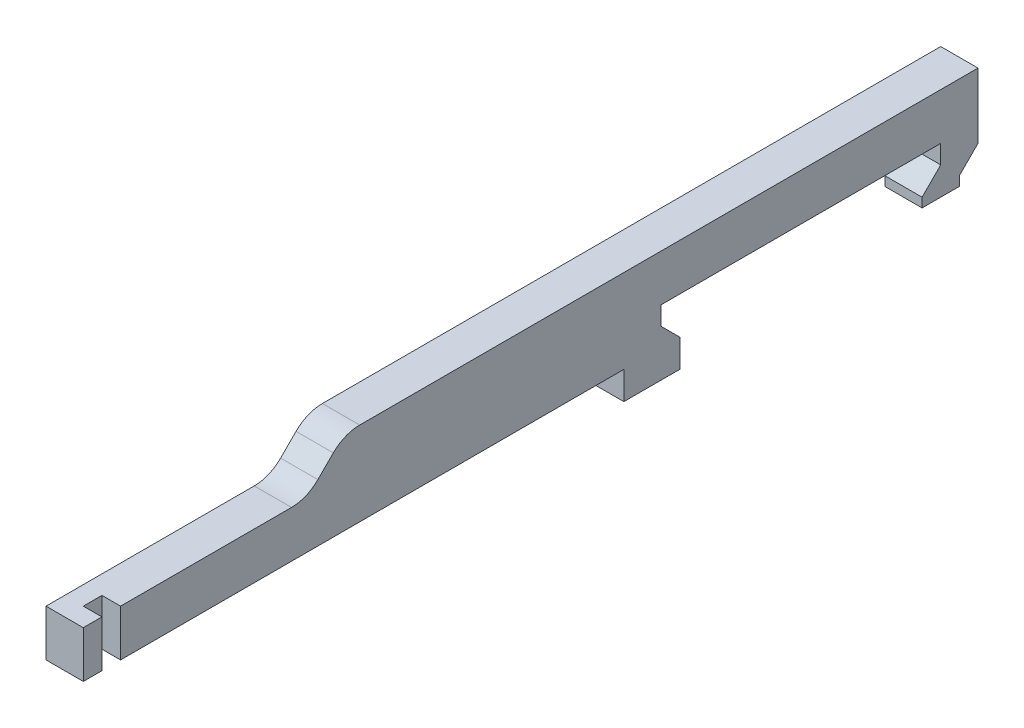
from build123d import *

# Parameters (mm, degrees)
EXTRUDE_1_DEPTH     = 2
FILLET_1_R          = 2
SKETCH_3_W          = 1
SKETCH_3_H          = 1
CUT_EXTRUDE_1_DEPTH = 49.207883173


with BuildPart() as part:
    # Эскиз1 → Бобышка-Вытянуть1 (new body)
    with BuildSketch(Plane(origin=(0, 0, 0), x_dir=(0, 0, -1), z_dir=(1, 0, 0))):
        Polygon((0, 0), (29, 0), (29, -1.5), (32, -1.5), (32, 0), (31, 1), (31, 2), (46, 2), (46, 1), (45, 0), (45, -0.5), (47, -0.5), (47, 0), (48, 1), (48, 4.5), (14, 4.5), (12, 2.5), (0, 2.5), align=None)
    extrude(amount=EXTRUDE_1_DEPTH)

    # Скругление1
    fillet_1_edges = [part.edges().sort_by_distance(p)[0] for p in [
        (1, 4.5, -14),
        (1, 2.5, -12),
    ]]
    fillet(fillet_1_edges, radius=FILLET_1_R)

    # Эскиз3 → Вырез-Вытянуть1 (cut, through all)
    with BuildSketch(Plane(origin=(0, 2.5, 0), x_dir=(1, 0, 0), z_dir=(0, 1, 0))):
        with Locations((1.5, 1.5)):
            Rectangle(SKETCH_3_W, SKETCH_3_H)
    extrude(amount=-CUT_EXTRUDE_1_DEPTH, mode=Mode.SUBTRACT)


solid = part.part
